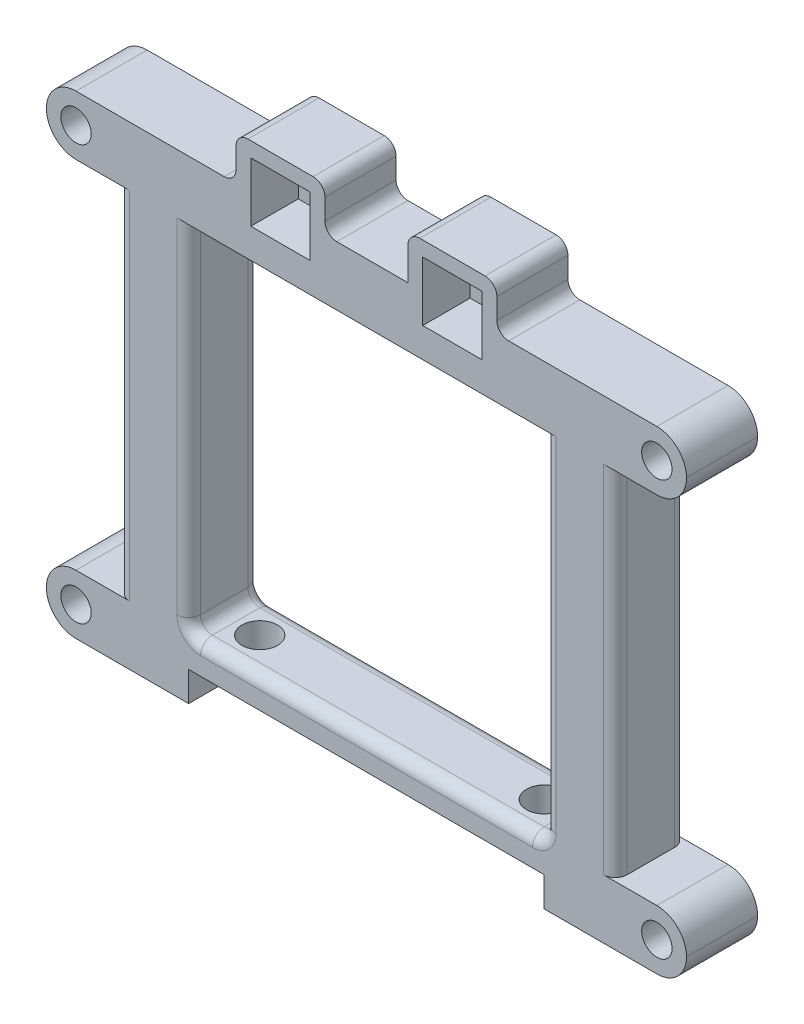
from build123d import *

# Parameters (mm, degrees)
SKETCH3_W           = 38.1
SKETCH3_H           = 38.1
BOSS_EXTRUDE2_DEPTH = 3.81
FILLET1_R           = 3.175
CUT_EXTRUDE1_REACH  = 65.074
SKETCH4_R           = 1.627
FILLET2_R           = 1.27
CUT_EXTRUDE2_REACH  = 64.728
SKETCH5_R           = 1.905
SKETCH7_W           = 6.35
SKETCH7_H           = 6.35
CUT_EXTRUDE4_DEPTH  = 5.08


with BuildPart() as part:
    # Sketch3 → Boss-Extrude2 (new, symmetric)
    with BuildSketch(Plane.XY):
        Polygon((34.29, -3.175), (34.29, 3.175), (26.67, 3.175), (26.67, 41.275), (34.29, 41.275), (34.29, 47.625), (13.97, 47.625), (13.97, 52.3875), (4.445, 52.3875), (4.445, 47.625), (-4.445, 47.625), (-4.445, 52.3875), (-13.97, 52.3875), (-13.97, 47.625), (-34.29, 47.625), (-34.29, 41.275), (-26.67, 41.275), (-26.67, 3.175), (-34.29, 3.175), (-34.29, -3.175), (-19.05, -3.175), (-19.05, 0), (19.05, 0), (19.05, -3.175), align=None)
        with Locations((0, 22.225)):
            Rectangle(SKETCH3_W, SKETCH3_H, mode=Mode.SUBTRACT)
    extrude(amount=BOSS_EXTRUDE2_DEPTH, both=True)

    # Fillet1
    fillet1_edges = [part.edges().sort_by_distance(p)[0] for p in [
        (34.29, 3.175, 0),
        (34.29, 41.275, 0),
        (34.29, 47.625, 0),
        (-34.29, 3.175, 0),
        (-34.29, 41.275, 0),
        (34.29, -3.175, 0),
        (-34.29, -3.175, 0),
        (-34.29, 47.625, 0),
    ]]
    fillet(fillet1_edges, radius=FILLET1_R - 0.0001)  # a hair under: the kernel refuses the full size

    # Sketch4 → Cut-Extrude1 (cut, up to next)
    with BuildSketch(Plane.XY.offset(3.81), mode=Mode.PRIVATE) as cut_extrude1_sk1:
        with Locations((-31.115, 44.45)):
            Circle(SKETCH4_R)
    cut_extrude1_tool1 = extrude(cut_extrude1_sk1.sketch, amount=-CUT_EXTRUDE1_REACH, mode=Mode.PRIVATE) & part.part
    # Sketch4 → Cut-Extrude1 (cut, up to next)
    with BuildSketch(Plane.XY.offset(3.81), mode=Mode.PRIVATE) as cut_extrude1_sk2:
        with Locations((-31.115, 0)):
            Circle(SKETCH4_R)
    cut_extrude1_tool2 = extrude(cut_extrude1_sk2.sketch, amount=-CUT_EXTRUDE1_REACH, mode=Mode.PRIVATE) & part.part
    cut_extrude1_1 = cut_extrude1_tool1.solids().sort_by_distance((-31.115, 44.45, 3.81))[0]
    add(cut_extrude1_1, mode=Mode.SUBTRACT)
    cut_extrude1_2 = cut_extrude1_tool2.solids().sort_by_distance((-31.115, 0, 3.81))[0]
    add(cut_extrude1_2, mode=Mode.SUBTRACT)
    cut_extrude1 = cut_extrude1_1 + cut_extrude1_2  # Cut-Extrude1 as one shape, for the pattern or mirror that repeats it

    # Mirror1: Cut-Extrude1 across plane
    add(cut_extrude1.mirror(Plane(origin=(0, 0, 0), x_dir=(0, 0, 1), z_dir=(1, 0, 0))), mode=Mode.SUBTRACT)

    # Fillet2
    fillet2_edges = [part.edges().sort_by_distance(p)[0] for p in [
        (-26.67, 22.225, -3.81),
        (26.67, 22.225, -3.81),
        (-13.97, 47.625, 0),
        (-13.97, 52.3875, 0),
        (-4.445, 52.3875, 0),
        (-4.445, 47.625, 0),
        (4.445, 52.3875, 0),
        (13.97, 52.3875, 0),
        (26.67, 22.225, 3.81),
        (13.97, 47.625, 0),
        (-19.05, 22.225, -3.81),
        (0, 3.175, -3.81),
        (-19.05, 3.175, 0),
        (19.05, 22.225, -3.81),
        (19.05, 3.175, 0),
        (-19.05, 22.225, 3.81),
        (0, 3.175, 3.81),
        (19.05, 22.225, 3.81),
        (-26.67, 22.225, 3.81),
    ]]
    fillet(fillet2_edges, radius=FILLET2_R)

    # Sketch5 → Cut-Extrude2 (cut, up to next)
    with BuildSketch(Plane.XZ, mode=Mode.PRIVATE) as cut_extrude2_sk1:
        with Locations((-15.24, 0)):
            Circle(SKETCH5_R)
    cut_extrude2_tool1 = extrude(cut_extrude2_sk1.sketch, amount=-CUT_EXTRUDE2_REACH, mode=Mode.PRIVATE) & part.part
    # Sketch5 → Cut-Extrude2 (cut, up to next)
    with BuildSketch(Plane.XZ, mode=Mode.PRIVATE) as cut_extrude2_sk2:
        with Locations(Location((15.24, 0, 0), (0, 0, 180))):
            Circle(SKETCH5_R)
    cut_extrude2_tool2 = extrude(cut_extrude2_sk2.sketch, amount=-CUT_EXTRUDE2_REACH, mode=Mode.PRIVATE) & part.part
    add(cut_extrude2_tool1.solids().sort_by_distance((-15.24, 0, 0))[0], mode=Mode.SUBTRACT)
    add(cut_extrude2_tool2.solids().sort_by_distance((15.24, 0, 0))[0], mode=Mode.SUBTRACT)

    # Sketch7 → Cut-Extrude4 (cut)
    with BuildSketch(Plane.XY.offset(3.81)):
        with Locations((-9.2075, 47.625)):
            Rectangle(SKETCH7_W, SKETCH7_H)
    cut_extrude4 = extrude(amount=-CUT_EXTRUDE4_DEPTH, mode=Mode.SUBTRACT)

    # Mirror2: Cut-Extrude4 across plane
    add(cut_extrude4.mirror(Plane(origin=(0, 0, 0), x_dir=(0, 0, 1), z_dir=(1, 0, 0))), mode=Mode.SUBTRACT)


solid = part.part
